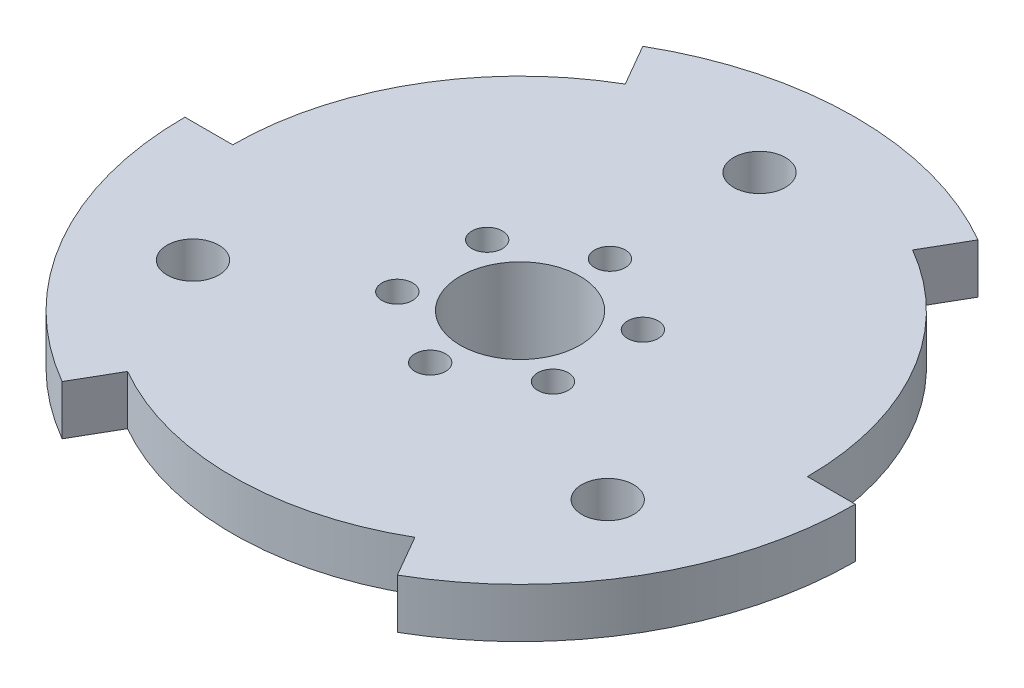
from build123d import *

# Parameters (mm, degrees)
SKETCH7_R               = 16.1
BOSS_EXTRUDE2_DEPTH     = 5
SKETCH1_R               = 2.707265749
SKETCH1_R_2             = 6.25
BOSS_EXTRUDE1_DEPTH     = 5.18
CUT_EXTRUDE1_DEPTH      = 51.533478012
CUT_EXTRUDE1_DEPTH_BACK = 51.533478012
SKETCH6_R               = 1.6
SKETCH9_R               = 1.6
SKETCH9_R_2             = 2.707265749
SKETCH9_R_3             = 6.25
CUT_EXTRUDE2_DEPTH      = 51.533478012


with BuildPart() as part:
    # Sketch7 → Boss-Extrude2 (new body)
    with BuildSketch(Plane(origin=(0, 0, 0), x_dir=(1, 0, 0), z_dir=(0, 1, 0))):
        Circle(SKETCH7_R)
    extrude(amount=BOSS_EXTRUDE2_DEPTH)

    # Sketch1 → Boss-Extrude1 (add)
    with BuildSketch(Plane(origin=(0, 5, 0), x_dir=(1, 0, 0), z_dir=(0, 1, 0))):
        with BuildLine():
            ThreePointArc((30, 0), (25.980762114, 15), (15, 25.980762114))
            Line((15, 25.980762114), (17.5, 30.310889132))
            ThreePointArc((17.5, 30.310889132), (0, 35), (-17.5, 30.310889132))
            Line((-17.5, 30.310889132), (-15, 25.980762114))
            ThreePointArc((-15, 25.980762114), (-25.980762114, 15), (-30, 0))
            Line((-30, 0), (-35, 0))
            ThreePointArc((-35, 0), (-30.310889132, -17.5), (-17.5, -30.310889132))
            Line((-17.5, -30.310889132), (-15, -25.980762114))
            ThreePointArc((-15, -25.980762114), (0, -30), (15, -25.980762114))
            Line((15, -25.980762114), (17.5, -30.310889132))
            ThreePointArc((17.5, -30.310889132), (30.310889132, -17.5), (35, 0))
            Line((35, 0), (30, 0))
        make_face()
        with Locations((-21.650635095, -12.5)):
            Circle(SKETCH1_R, mode=Mode.SUBTRACT)
        with Locations((21.650635095, -12.5)):
            Circle(SKETCH1_R, mode=Mode.SUBTRACT)
        Circle(SKETCH1_R_2, mode=Mode.SUBTRACT)
        with Locations((0, 25)):
            Circle(SKETCH1_R, mode=Mode.SUBTRACT)
    extrude(amount=BOSS_EXTRUDE1_DEPTH)

    # Sketch6 → Cut-Extrude1 (cut, two sides: drawn at the far end of the back side and taken through both)
    with BuildSketch(Plane(origin=(0, 10.18, 0), x_dir=(1, 0, 0), z_dir=(0, 1, 0)).offset(-CUT_EXTRUDE1_DEPTH_BACK)):
        with Locations((0, -9.385)):
            Circle(SKETCH6_R)
        with Locations((-8.127648415, -4.6925)):
            Circle(SKETCH6_R)
        with Locations((-8.127648415, 4.6925)):
            Circle(SKETCH6_R)
        with Locations((0, 9.385)):
            Circle(SKETCH6_R)
        with Locations((8.127648415, 4.6925)):
            Circle(SKETCH6_R)
        with Locations((8.127648415, -4.6925)):
            Circle(SKETCH6_R)
    extrude(amount=CUT_EXTRUDE1_DEPTH + CUT_EXTRUDE1_DEPTH_BACK, mode=Mode.SUBTRACT)

    # Sketch9 → Cut-Extrude2 (cut, through all)
    with BuildSketch(Plane(origin=(0, 10.18, 0), x_dir=(1, 0, 0), z_dir=(0, 1, 0))):
        with Locations((8.127648415, -4.6925)):
            Circle(SKETCH9_R)
        with Locations((8.127648415, 4.6925)):
            Circle(SKETCH9_R)
        with Locations((0, 9.385)):
            Circle(SKETCH9_R)
        with Locations((-8.127648415, 4.6925)):
            Circle(SKETCH9_R)
        with Locations((-8.127648415, -4.6925)):
            Circle(SKETCH9_R)
        with Locations((21.650635095, -12.5)):
            Circle(SKETCH9_R_2)
        with Locations((0, 25)):
            Circle(SKETCH9_R_2)
        with Locations((-21.650635095, -12.5)):
            Circle(SKETCH9_R_2)
        Circle(SKETCH9_R_3)
    extrude(amount=-CUT_EXTRUDE2_DEPTH, mode=Mode.SUBTRACT)


solid = part.part
